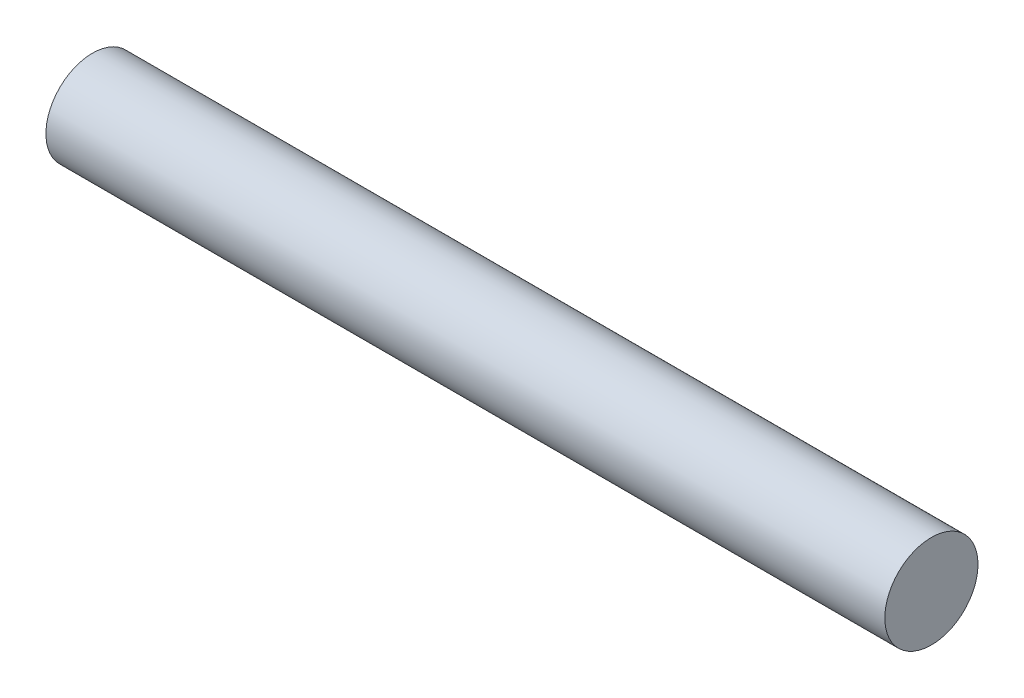
from build123d import *

# Parameters (mm, degrees)
SKETCH2_R           = 6.35
BOSS_EXTRUDE1_DEPTH = 114.3


with BuildPart() as part:
    # Sketch2 → Boss-Extrude1 (new body)
    with BuildSketch(Plane(origin=(0, 0, 0), x_dir=(0, 0, -1), z_dir=(1, 0, 0))):
        Circle(SKETCH2_R)
    extrude(amount=BOSS_EXTRUDE1_DEPTH)


solid = part.part
